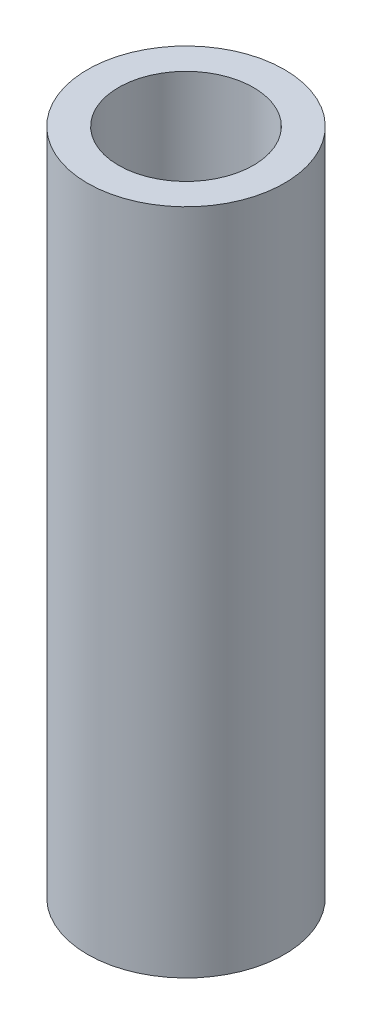
from build123d import *

# Parameters (mm, degrees)
SWEEP_SOTTILE1_PROFILE_R   = 3.175
SWEEP_SOTTILE1_PROFILE_R_2 = 2.175


with BuildPart() as part:
    # Sweep-Sottile1: sweep along a path in Schizzo1
    with BuildLine(Plane.XY) as sweep_sottile1_path:
        Line((0, 0), (0, 21.530838572))
    # Sweep-Sottile1 profile (on start of the path) → Sweep-Sottile1 (sweep)
    with BuildSketch(Plane.ZX):
        Circle(SWEEP_SOTTILE1_PROFILE_R)
        Circle(SWEEP_SOTTILE1_PROFILE_R_2, mode=Mode.SUBTRACT)
    sweep(path=sweep_sottile1_path.line)


solid = part.part
